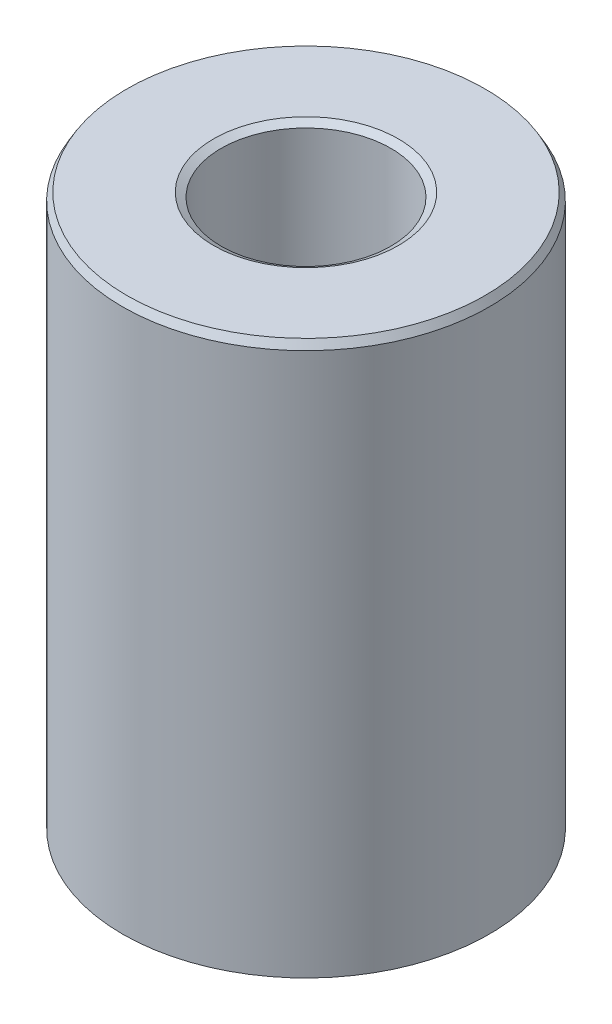
from build123d import *
from OCP.BRepFilletAPI import BRepFilletAPI_MakeChamfer

# Parameters (mm, degrees)
SKETCH1_R           = 12.5
BOSS_EXTRUDE1_DEPTH = 37.835454389
SKETCH2_R           = 5.78374091
CUT_EXTRUDE1_DEPTH  = 42.761484754
CHAMFER1_SIZE       = 0.51631967
CHAMFER1_SIZE2      = 0.298097301


with BuildPart() as part:
    # Sketch1 → Boss-Extrude1 (new body)
    with BuildSketch(Plane(origin=(0, 0, 0), x_dir=(1, 0, 0), z_dir=(0, 1, 0))):
        Circle(SKETCH1_R)
    extrude(amount=BOSS_EXTRUDE1_DEPTH)

    # Sketch2 → Cut-Extrude1 (cut, through all)
    with BuildSketch(Plane(origin=(0, 0, 0), x_dir=(1, 0, 0), z_dir=(0, 1, 0))):
        Circle(SKETCH2_R)
    extrude(amount=CUT_EXTRUDE1_DEPTH, mode=Mode.SUBTRACT)

    # Chamfer1: one chamfer whose edges measure the first distance from different faces: ONE call of the kernel's chamfer builder (chamfer() names one face for all edges)
    chamfer1_edges_1 = [part.edges().sort_by_distance(p)[0] for p in [
        (-5.78374091, 37.835454389, 0),
    ]]
    chamfer1_side_1 = [part.faces().sort_by_distance(p)[0] for p in [
        (-12.146446609, 37.835454389, 0),
    ]]
    chamfer1_edges_2 = [part.edges().sort_by_distance(p)[0] for p in [
        (-5.78374091, 0, 0),
    ]]
    chamfer1_side_2 = [part.faces().sort_by_distance(p)[0] for p in [
        (-5.78374091, 18.917727195, 0),
    ]]
    chamfer1_edges_3 = [part.edges().sort_by_distance(p)[0] for p in [
        (-12.5, 0, 0),
    ]]
    chamfer1_side_3 = [part.faces().sort_by_distance(p)[0] for p in [
        (-12.146446609, 0, 0),
    ]]
    chamfer1_edges_4 = [part.edges().sort_by_distance(p)[0] for p in [
        (-12.5, 37.835454389, 0),
    ]]
    chamfer1_side_4 = [part.faces().sort_by_distance(p)[0] for p in [
        (-12.5, 18.917727195, 0),
    ]]
    chamfer1 = BRepFilletAPI_MakeChamfer(part.part.solid().wrapped)
    for e in chamfer1_edges_1:
        chamfer1.Add(CHAMFER1_SIZE, CHAMFER1_SIZE2, e.wrapped, chamfer1_side_1[0].wrapped)  # the first distance lies on this face
    for e in chamfer1_edges_2:
        chamfer1.Add(CHAMFER1_SIZE, CHAMFER1_SIZE2, e.wrapped, chamfer1_side_2[0].wrapped)  # the first distance lies on this face
    for e in chamfer1_edges_3:
        chamfer1.Add(CHAMFER1_SIZE, CHAMFER1_SIZE2, e.wrapped, chamfer1_side_3[0].wrapped)  # the first distance lies on this face
    for e in chamfer1_edges_4:
        chamfer1.Add(CHAMFER1_SIZE, CHAMFER1_SIZE2, e.wrapped, chamfer1_side_4[0].wrapped)  # the first distance lies on this face
    add(Compound.cast(chamfer1.Shape()), mode=Mode.REPLACE)


solid = part.part
